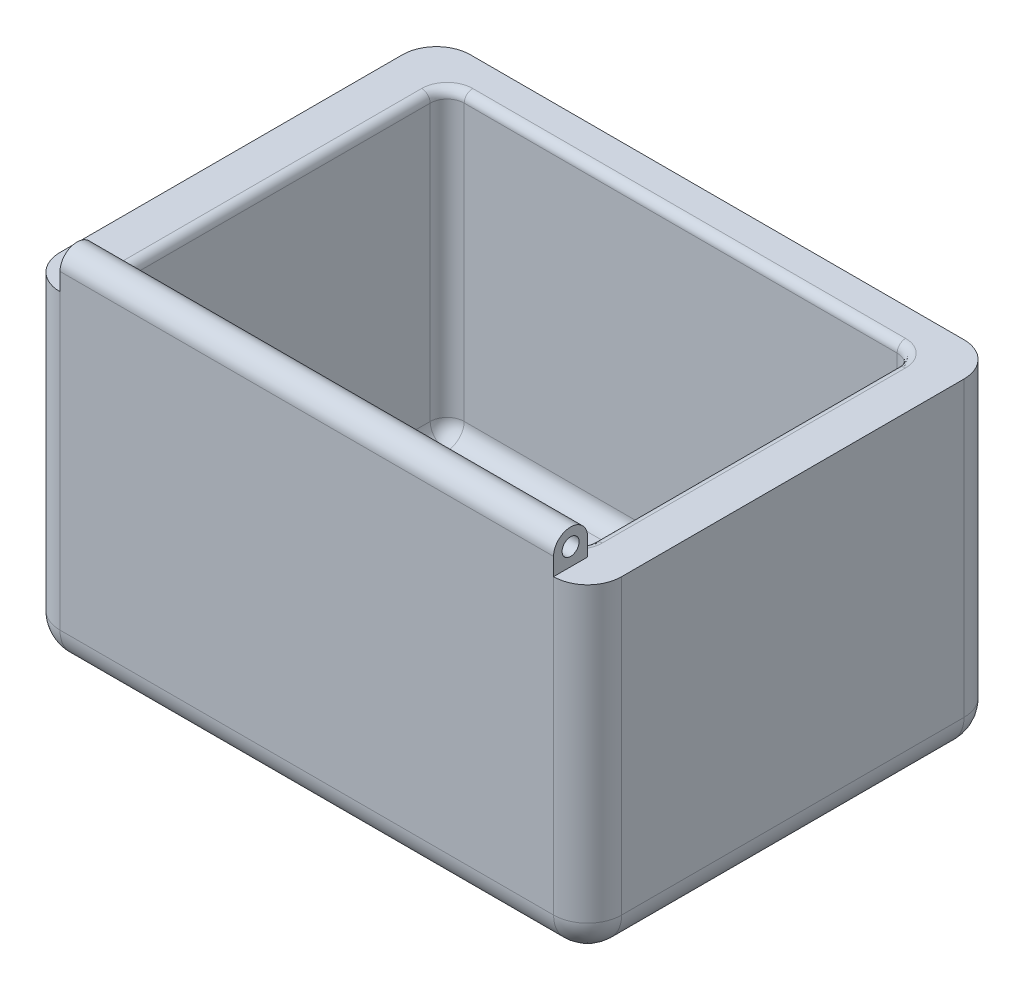
from build123d import *

# Parameters (mm, degrees)
SKETCH1_W           = 330.2
SKETCH1_H           = 241.3
BOSS_EXTRUDE3_DEPTH = 192.3
SKETCH4_W           = 274.574
SKETCH4_H           = 198.374
CUT_EXTRUDE1_DEPTH  = 176.276
CUT_EXTRUDE1_DRAFT  = -0.256
FILLET1_R           = 20
FILLET2_R           = 20
FILLET3_R           = 10
FILLET4_R           = 5
SKETCH5_R           = 5
BOSS_EXTRUDE4_DEPTH = 290.2


with BuildPart() as part:
    # Sketch1 → Boss-Extrude3 (new body)
    with BuildSketch(Plane(origin=(0, 0, 0), x_dir=(1, 0, 0), z_dir=(0, 1, 0))):
        Rectangle(SKETCH1_W, SKETCH1_H)
    extrude(amount=BOSS_EXTRUDE3_DEPTH)


with BuildPart() as cut_extrude1_tool:
    # Sketch4 → Cut-Extrude1 (with draft: the straight prism first)
    with BuildSketch(Plane(origin=(0, 192.3, 0), x_dir=(1, 0, 0), z_dir=(0, 1, 0))):
        Rectangle(SKETCH4_W, SKETCH4_H)
    extrude(amount=-CUT_EXTRUDE1_DEPTH)
    # Cut-Extrude1: the draft: its side faces are tilted about the plane it starts from
    cut_extrude1_sides = [cut_extrude1_tool.faces().sort_by_distance(p)[0] for p in [
        (0, 104.162, 99.187),
        (137.287, 104.162, 0),
        (0, 104.162, -99.187),
        (-137.287, 104.162, 0),
    ]]
    draft(cut_extrude1_sides, Plane(origin=(0, 192.3, 0), x_dir=(1, 0, 0), z_dir=(0, 1, 0)), CUT_EXTRUDE1_DRAFT)


with BuildPart() as part_1:
    add(part.part)

    # Cut-Extrude1: cut by cut_extrude1_tool
    add(cut_extrude1_tool.part, mode=Mode.SUBTRACT)

    # Fillet1
    fillet1_edges = [part_1.edges().sort_by_distance(p)[0] for p in [
        (0, 0, 120.65),
        (-165.1, 0, 0),
        (0, 0, -120.65),
        (165.1, 96.15, 120.65),
        (-165.1, 96.15, 120.65),
        (-165.1, 96.15, -120.65),
        (165.1, 96.15, -120.65),
    ]]
    fillet(fillet1_edges, radius=FILLET1_R)

    # Fillet2
    # the kernel refuses this fillet: 20 mm, written as the material it takes off along each edge
    with BuildSketch(Plane(origin=(145.1, 20, 100.65), x_dir=(0, -1, 0), z_dir=(1, 0, 0))) as fillet2_piece_1_section:
        Polygon((0, 0), (FILLET2_R, 0), (FILLET2_R, -FILLET2_R), (0, -FILLET2_R), align=None)
    fillet2_piece_1 = extrude(amount=FILLET2_R, mode=Mode.PRIVATE)
    fillet2_piece_1 = fillet2_piece_1 - Plane(origin=(145.1, 20, 100.65), x_dir=(0, 0.7071067811865475, -0.7071067811865475), z_dir=(1, 0, 0)) * Sphere(FILLET2_R, mode=Mode.PRIVATE)
    add(fillet2_piece_1, mode=Mode.SUBTRACT)
    with BuildSketch(Plane(origin=(145.1, 20, -100.65), x_dir=(0, -1, 0), z_dir=(1, 0, 0))) as fillet2_piece_2_section:
        Polygon((0, 0), (FILLET2_R, 0), (FILLET2_R, FILLET2_R), (0, FILLET2_R), align=None)
    fillet2_piece_2 = extrude(amount=FILLET2_R, mode=Mode.PRIVATE)
    fillet2_piece_2 = fillet2_piece_2 - Plane(origin=(145.1, 20, -100.65), x_dir=(0, 0.7071067811865475, 0.7071067811865475), z_dir=(1, 0, 0)) * Sphere(FILLET2_R, mode=Mode.PRIVATE)
    add(fillet2_piece_2, mode=Mode.SUBTRACT)
    with BuildSketch(Plane(origin=(165.1, 0, 100.65), x_dir=(0, 1, 0), z_dir=(0, 0, -1))) as fillet2_piece_3:
        with BuildLine():
            CenterArc((FILLET2_R, -FILLET2_R), FILLET2_R, 90, 90)
            Line((0, -FILLET2_R), (0, 0))
            Line((0, 0), (FILLET2_R, 0))
        make_face()
    extrude(amount=201.3, mode=Mode.SUBTRACT)

    # Fillet3
    fillet3_edges = [part_1.edges().sort_by_distance(p)[0] for p in [
        (136.499386031, 16.024, 0),
        (136.893193016, 104.162, -98.793193016),
        (0, 16.024, 98.399386031),
        (136.893193016, 104.162, 98.793193016),
        (-136.499386031, 16.024, 0),
        (-136.893193016, 104.162, 98.793193016),
        (0, 16.024, -98.399386031),
        (-136.893193016, 104.162, -98.793193016),
    ]]
    fillet(fillet3_edges, radius=FILLET3_R)

    # Fillet4
    fillet4_edges = [part_1.edges().sort_by_distance(p)[0] for p in [
        (0, 192.3, -99.187),
        (137.287, 192.3, 0),
        (-137.287, 192.3, 0),
        (0, 192.3, 99.187),
        (134.358109157, 192.3, -96.258109157),
        (-134.358109157, 192.3, -96.258109157),
        (134.358109157, 192.3, 96.258109157),
        (-134.358109157, 192.3, 96.258109157),
    ]]
    fillet(fillet4_edges, radius=FILLET4_R)

    # Sketch5 → Boss-Extrude4 (add)
    with BuildSketch(Plane.YZ.offset(145.1)):
        with BuildLine():
            Line((202.619228494, 120.65), (192.3, 120.65))
            Line((192.3, 120.65), (192.3, 100.65))
            Line((192.3, 100.65), (202.619228494, 100.65))
            ThreePointArc((202.619228494, 100.65), (212.619228494, 110.65), (202.619228494, 120.65))
        make_face()
        with Locations((202.619228494, 110.65)):
            Circle(SKETCH5_R, mode=Mode.SUBTRACT)
    extrude(amount=-BOSS_EXTRUDE4_DEPTH)


solid = part_1.part
